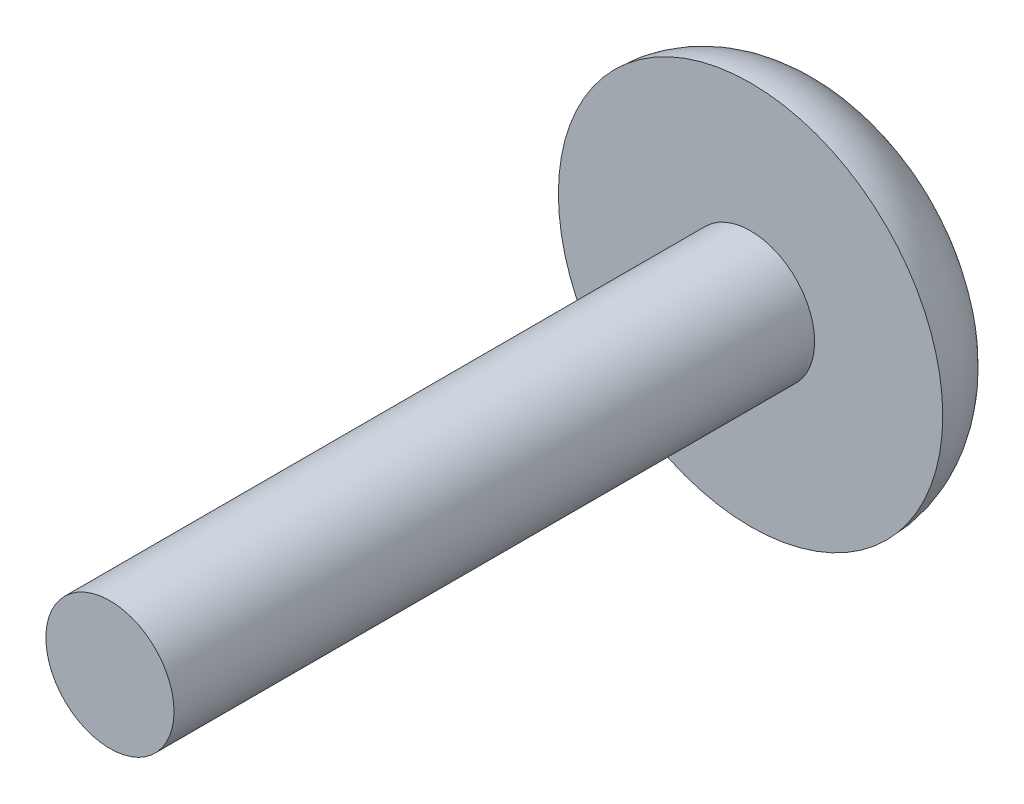
from build123d import *

# Parameters (mm, degrees)
SKETCH1_R           = 4.5
BOSS_EXTRUDE1_DEPTH = 2
FILLET1_R           = 2
CUT_EXTRUDE1_DEPTH  = 0.5
SKETCH3_R           = 1.5
BOSS_EXTRUDE2_DEPTH = 15


with BuildPart() as part:
    # Sketch1 → Boss-Extrude1 (new body)
    with BuildSketch(Plane.XY):
        Circle(SKETCH1_R)
    extrude(amount=BOSS_EXTRUDE1_DEPTH)

    # Fillet1
    fillet1_edges = [part.edges().sort_by_distance(p)[0] for p in [
        (-4.5, 0, 0),
    ]]
    fillet(fillet1_edges, radius=FILLET1_R - 0.0001)  # a hair under: the kernel refuses the full size

    # Sketch2 → Cut-Extrude1 (cut)
    with BuildSketch(Plane(origin=(0, 0, 0), x_dir=(-1, 0, 0), z_dir=(0, 0, -1))):
        Polygon((0.230798636, -0.25), (0.230798636, -1.45), (-0.269201364, -1.45), (-0.230798636, -0.25), (-1.430798636, -0.25), (-1.430798636, 0.25), (-0.230798636, 0.25), (-0.230798636, 1.45), (0.230798636, 1.45), (0.230798636, 0.25), (1.430798636, 0.25), (1.430798636, -0.25), align=None)
    extrude(amount=-CUT_EXTRUDE1_DEPTH, mode=Mode.SUBTRACT)

    # Sketch3 → Boss-Extrude2 (add)
    with BuildSketch(Plane.XY.offset(2)):
        Circle(SKETCH3_R)
    extrude(amount=BOSS_EXTRUDE2_DEPTH)


solid = part.part
